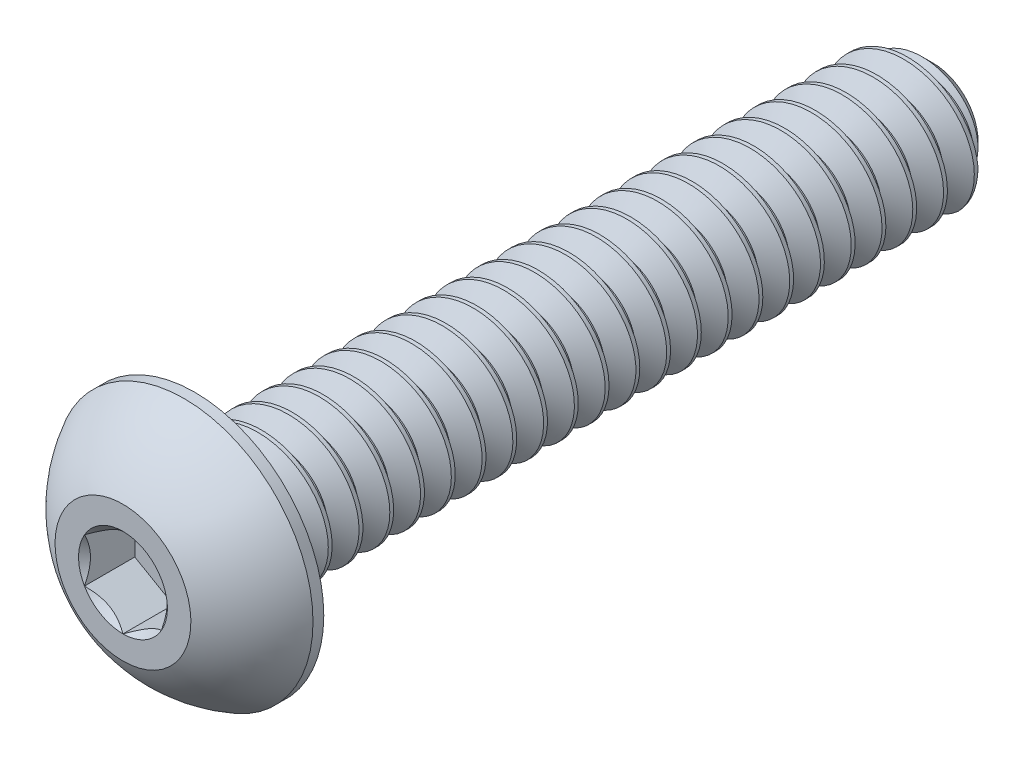
from build123d import *

# Parameters (mm, degrees)
SKETCH1_W          = 19.05
SKETCH1_H          = 1.7526
CHAMFER1_SIZE      = 0.5953125
CUT_SWEEP1_PITCH   = 0.79375
CUT_EXTRUDE2_DEPTH = 1.29794


with BuildPart() as part:
    # Sketch1 → Revolve1 (revolve)
    with BuildSketch(Plane(origin=(0, 0, 0), x_dir=(0, 0, -1), z_dir=(1, 0, 0))):
        with Locations((11.3792, 0.8763)):
            Rectangle(SKETCH1_W, SKETCH1_H)
    revolve(axis=Axis((0, 0, -20.9042), (0, 0, 1)))

    # Chamfer1
    chamfer1_edges = [part.edges().sort_by_distance(p)[0] for p in [
        (0, -1.7526, -20.9042),
    ]]
    chamfer(chamfer1_edges, length=CHAMFER1_SIZE)

    # Cut-Sweep1: arcs per turn and ends read off the stored shape
    # Cut-Sweep1: the profile of Sketch2 profile screwed along a right-hand helix through 25 turns, 8 arcs to a turn; built about Z, then put on its axis
    cut_sweep1_z = Axis((0, 0, 0), (0, 0, 1))
    cut_sweep1_corners = [(1.7529, 0, 0.000173205), (1.7529, 0, -0.694704455), (1.237044252, 0, -0.396875), (1.237044252, 0, -0.29765625)]
    with BuildLine(mode=Mode.PRIVATE) as cut_sweep1_profile:
        Line(cut_sweep1_corners[0], cut_sweep1_corners[1])
        Line(cut_sweep1_corners[1], cut_sweep1_corners[2])
        Line(cut_sweep1_corners[2], cut_sweep1_corners[3])
        Line(cut_sweep1_corners[3], cut_sweep1_corners[0])
    cut_sweep1_cap = Face(cut_sweep1_profile.wire())
    cut_sweep1_turn_angles = [0, 22.5, 45, 67.5, 90, 112.5, 135, 157.5, 180, 202.5, 225, 247.5, 270, 292.5, 315, 337.5, 360]
    cut_sweep1_turn_weights = [1, 0.9238795325112867, 1, 0.9238795325112867, 1, 0.9238795325112867, 1, 0.9238795325112867, 1, 0.9238795325112867, 1, 0.9238795325112867, 1, 0.9238795325112867, 1, 0.9238795325112867, 1]
    cut_sweep1_turn_rails = [Edge.make_bspline([Vector(p[0], p[1], 0).rotate(cut_sweep1_z, cut_sweep1_turn_angles[k]) / cut_sweep1_turn_weights[k] + Vector(0, 0, p[2] + CUT_SWEEP1_PITCH * cut_sweep1_turn_angles[k] / 360) for k in range(17)], [0, 0, 0, 1, 1, 2, 2, 3, 3, 4, 4, 5, 5, 6, 6, 7, 7, 8, 8, 8], 2, cut_sweep1_turn_weights) for p in cut_sweep1_corners]
    cut_sweep1_turn_sides = [Face.make_surface_from_curves(cut_sweep1_turn_rails[p[0]], cut_sweep1_turn_rails[p[1]]) for p in [(0, 1), (1, 2), (2, 3), (3, 0)]]
    cut_sweep1 = Plane(origin=(0, 0, -20.9042), x_dir=(0, 1, 0), z_dir=(0, 0, 1)) * Solid(Shell([*[p.moved(Location((0, 0, CUT_SWEEP1_PITCH * i))) for i in range(25) for p in cut_sweep1_turn_sides], cut_sweep1_cap, cut_sweep1_cap.rotate(cut_sweep1_z, 9000).moved(Location((0, 0, CUT_SWEEP1_PITCH * 9000 / 360)))]))
    add(cut_sweep1, mode=Mode.SUBTRACT)

    # Sketch7 → Revolve2 (revolve)
    with BuildSketch(Plane(origin=(0, 0, 0), x_dir=(0, 0, -1), z_dir=(1, 0, 0)), mode=Mode.PRIVATE) as revolve2_sk:
        with BuildLine():
            Line((1.57607, 3.3274), (1.8542, 3.3274))
            Line((1.8542, 3.3274), (1.8542, 0))
            Line((1.8542, 0), (0, 0))
            Line((0, 0), (0, 1.7526))
            ThreePointArc((0, 1.7526), (0.668695369, 2.659435873), (1.57607, 3.3274))
        make_face()
    revolve(revolve2_sk.sketch.rotate(Axis((0, 0, 0), (0, 0, -1)), 189.052465709), axis=Axis((0, 0, 0), (0, 0, -1)))

    # Sketch5 → Cut-Extrude2 (cut)
    with BuildSketch(Plane.XY):
        Polygon((0.9921875, -0.57283972), (0.9921875, 0.57283972), (0, 1.14567944), (-0.9921875, 0.57283972), (-0.9921875, -0.57283972), (0, -1.14567944), align=None)
    extrude(amount=-CUT_EXTRUDE2_DEPTH, mode=Mode.SUBTRACT)

    # Cut-Extrude3 cone 1 section (through the dimple's axis) → Cut-Extrude3 (revolve, cut)
    with BuildSketch(Plane(origin=(0, 0, 0), x_dir=(0, -1, 0), z_dir=(1, 0, 0))):
        Polygon((0, 0), (1.14567944, 0), (0, 1.14567944), align=None)
    revolve(axis=Axis((0, 0, 0), (0, 0, -1)), mode=Mode.SUBTRACT)


solid = part.part
